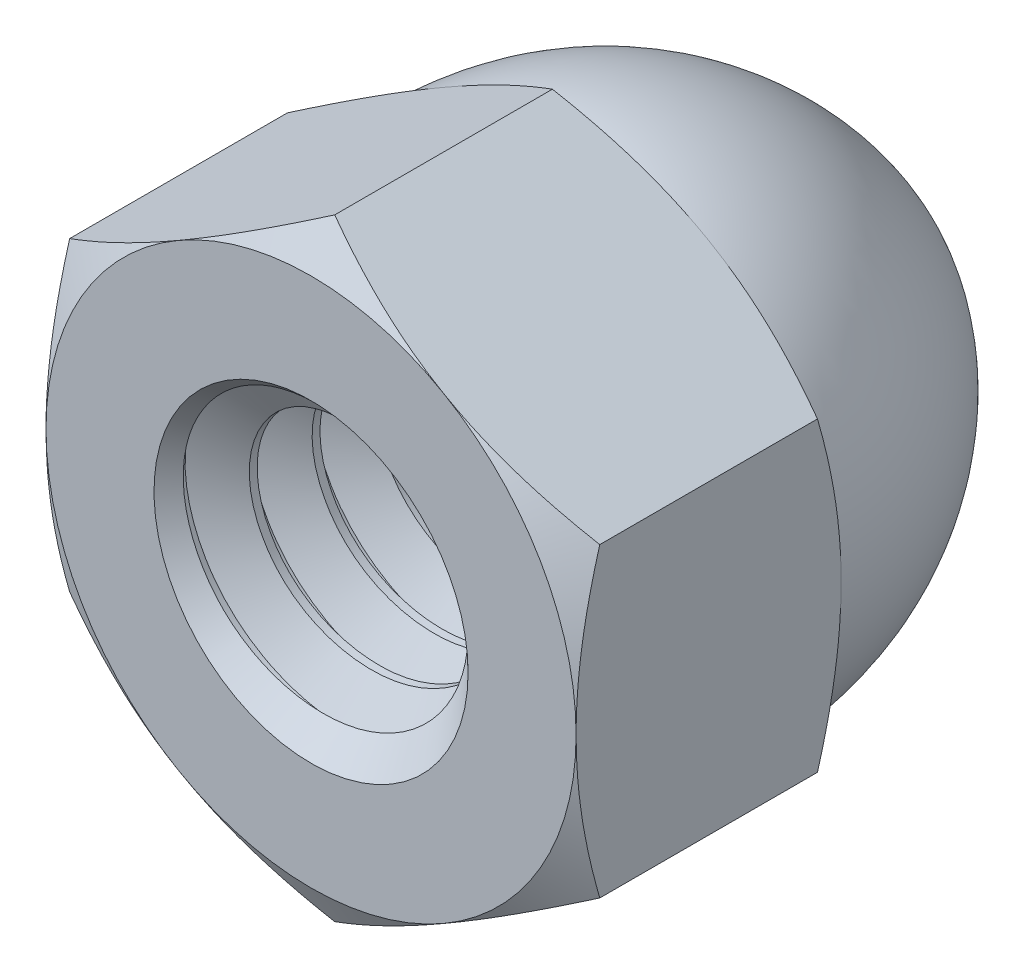
from build123d import *

# Parameters (mm, degrees)
EXTRUDE1_DEPTH     = 5.3578125
SKETCH2_OUTSIDE_W  = 53.51
SKETCH2_OUTSIDE_H  = 55.168
SKETCH2_OUTSIDE_R  = 5.3578125
CUT_EXTRUDE1_DEPTH = 10.78198255
CUT_EXTRUDE1_DRAFT = -60
SKETCH3_OUTSIDE_W  = 53.51
SKETCH3_OUTSIDE_H  = 55.168
SKETCH3_OUTSIDE_R  = 5.3578125
CUT_EXTRUDE2_DEPTH = 10.78198255
CUT_EXTRUDE2_DRAFT = -60
SKETCH4_R          = 3.175
CUT_EXTRUDE3_DEPTH = 7.9375
SWEEP1_PITCH       = 1.27
CUT_EXTRUDE8_DEPTH = 15.447830909


with BuildPart() as part:
    # Sketch1 → Extrude1 (new body)
    with BuildSketch(Plane.XY):
        Polygon((0, 6.186668978), (-5.3578125, 3.093334489), (-5.3578125, -3.093334489), (0, -6.186668978), (5.3578125, -3.093334489), (5.3578125, 3.093334489), align=None)
    extrude(amount=-EXTRUDE1_DEPTH)


with BuildPart() as cut_extrude1_tool:
    # Sketch2 outside → Cut-Extrude1 (with draft: the straight prism first)
    with BuildSketch(Plane.XY):
        Rectangle(SKETCH2_OUTSIDE_W, SKETCH2_OUTSIDE_H)
        Circle(SKETCH2_OUTSIDE_R, mode=Mode.SUBTRACT)
    extrude(amount=-CUT_EXTRUDE1_DEPTH)
    # Cut-Extrude1: the draft: its side faces are tilted about the plane it starts from
    cut_extrude1_sides = [cut_extrude1_tool.faces().sort_by_distance(p)[0] for p in [
        (0, -27.584, -5.390991275),
        (26.755, 0, -5.390991275),
        (0, 27.584, -5.390991275),
        (-26.755, 0, -5.390991275),
        (-5.3578125, 0, -5.390991275),
    ]]
    draft(cut_extrude1_sides, Plane.XY, CUT_EXTRUDE1_DRAFT)


with BuildPart() as part_1:
    add(part.part)

    # Cut-Extrude1: cut by cut_extrude1_tool
    add(cut_extrude1_tool.part, mode=Mode.SUBTRACT)


with BuildPart() as cut_extrude2_tool:
    # Sketch3 outside → Cut-Extrude2 (with draft: the straight prism first)
    with BuildSketch(Plane(origin=(0, 0, -5.3578125), x_dir=(-1, 0, 0), z_dir=(0, 0, -1))):
        Rectangle(SKETCH3_OUTSIDE_W, SKETCH3_OUTSIDE_H)
        Circle(SKETCH3_OUTSIDE_R, mode=Mode.SUBTRACT)
    extrude(amount=-CUT_EXTRUDE2_DEPTH)
    # Cut-Extrude2: the draft: its side faces are tilted about the plane it starts from
    cut_extrude2_sides = [cut_extrude2_tool.faces().sort_by_distance(p)[0] for p in [
        (0, -27.584, 0.033178775),
        (-26.755, 0, 0.033178775),
        (0, 27.584, 0.033178775),
        (26.755, 0, 0.033178775),
        (5.3578125, 0, 0.033178775),
    ]]
    draft(cut_extrude2_sides, Plane(origin=(0, 0, -5.3578125), x_dir=(-1, 0, 0), z_dir=(0, 0, -1)), CUT_EXTRUDE2_DRAFT)


with BuildPart() as part_2:
    add(part_1.part)

    # Cut-Extrude2: cut by cut_extrude2_tool
    add(cut_extrude2_tool.part, mode=Mode.SUBTRACT)

    # Sketch14 → Revolve1 (revolve)
    with BuildSketch(Plane(origin=(0, 0, 0), x_dir=(0, 0, -1), z_dir=(1, 0, 0))):
        with BuildLine():
            Line((5.3578125, 5.3578125), (5.3578125, 0))
            Line((5.3578125, 0), (11.90625, 0))
            ThreePointArc((11.90625, 0), (9.588302675, 3.847682436), (5.3578125, 5.3578125))
        make_face()
    revolve(axis=Axis((0, 0, 0), (0, 0, -1)))

    # Sketch4 → Cut-Extrude3 (cut)
    with BuildSketch(Plane.XY):
        Circle(SKETCH4_R)
    extrude(amount=-CUT_EXTRUDE3_DEPTH, mode=Mode.SUBTRACT)

    # Sweep1: arcs per turn and ends read off the stored shape
    # Sweep1: the profile of Sketch16 profile screwed along a left-hand helix through 9 turns, 6 arcs to a turn; built about Z, then put on its axis
    sweep1_z = Axis((0, 0, 0), (0, 0, 1))
    sweep1_corners = [(3.1753, 0, 0.000173205), (3.1753, 0, -1.111423205), (2.350110803, 0, -0.635), (2.350110803, 0, -0.47625)]
    with BuildLine(mode=Mode.PRIVATE) as sweep1_profile:
        Line(sweep1_corners[0], sweep1_corners[1])
        Line(sweep1_corners[1], sweep1_corners[2])
        Line(sweep1_corners[2], sweep1_corners[3])
        Line(sweep1_corners[3], sweep1_corners[0])
    sweep1_cap = Face(sweep1_profile.wire())
    sweep1_turn_angles = [0, -30, -60, -90, -120, -150, -180, -210, -240, -270, -300, -330, -360]
    sweep1_turn_weights = [1, 0.8660254037844387, 1, 0.8660254037844387, 1, 0.8660254037844387, 1, 0.8660254037844387, 1, 0.8660254037844387, 1, 0.8660254037844387, 1]
    sweep1_turn_rails = [Edge.make_bspline([Vector(p[0], p[1], 0).rotate(sweep1_z, sweep1_turn_angles[k]) / sweep1_turn_weights[k] + Vector(0, 0, p[2] + -SWEEP1_PITCH * sweep1_turn_angles[k] / 360) for k in range(13)], [0, 0, 0, 1, 1, 2, 2, 3, 3, 4, 4, 5, 5, 6, 6, 6], 2, sweep1_turn_weights) for p in sweep1_corners]
    sweep1_turn_sides = [Face.make_surface_from_curves(sweep1_turn_rails[p[0]], sweep1_turn_rails[p[1]]) for p in [(0, 1), (1, 2), (2, 3), (3, 0)]]
    sweep1_turn = Solid(Shell([*sweep1_turn_sides, sweep1_cap, sweep1_cap.rotate(sweep1_z, -360).moved(Location((0, 0, -SWEEP1_PITCH * -360 / 360)))]))
    sweep1_each = [*[sweep1_turn.moved(Location((0, 0, SWEEP1_PITCH * i))) for i in range(9)]]
    add(Plane(origin=(0, 0, -7.9375), x_dir=(0, 1, 0), z_dir=(0, 0, 1)) * Compound([sweep1_each[i] for i in range(0, 9, 2)]))
    add(Plane(origin=(0, 0, -7.9375), x_dir=(0, 1, 0), z_dir=(0, 0, 1)) * Compound([sweep1_each[i] for i in range(1, 9, 2)]))

    # Sketch17 → Cut-Extrude8 (cut, through all)
    with BuildSketch(Plane.XY):
        Polygon((0, 6.186668978), (-5.3578125, 3.093334489), (-5.3578125, -3.093334489), (0, -6.186668978), (5.3578125, -3.093334489), (5.3578125, 3.093334489), align=None)
    extrude(amount=CUT_EXTRUDE8_DEPTH, mode=Mode.SUBTRACT)

    # Cut-Extrude9 cone 1 section (through the dimple's axis) → Cut-Extrude9 (revolve, cut)
    with BuildSketch(Plane(origin=(0, 0, 0), x_dir=(0, -1, 0), z_dir=(1, 0, 0))):
        Polygon((0, 0), (3.175, 0), (0, 3.175), align=None)
    revolve(axis=Axis((0, 0, 0), (0, 0, -1)), mode=Mode.SUBTRACT)

    # Sketch20 → Cut-Revolve1 (revolve, cut)
    with BuildSketch(Plane(origin=(0, 0, 0), x_dir=(0, 0, -1), z_dir=(1, 0, 0)), mode=Mode.PRIVATE) as cut_revolve1_sk:
        Polygon((8.5725, 3.175), (10.405587105, 0), (7.9375, 0), (7.9375, 3.175), align=None)
    revolve(cut_revolve1_sk.sketch.rotate(Axis((0, 0, 0), (0, 0, 1)), 270), axis=Axis((0, 0, 0), (0, 0, 1)), mode=Mode.SUBTRACT)


solid = part_2.part
